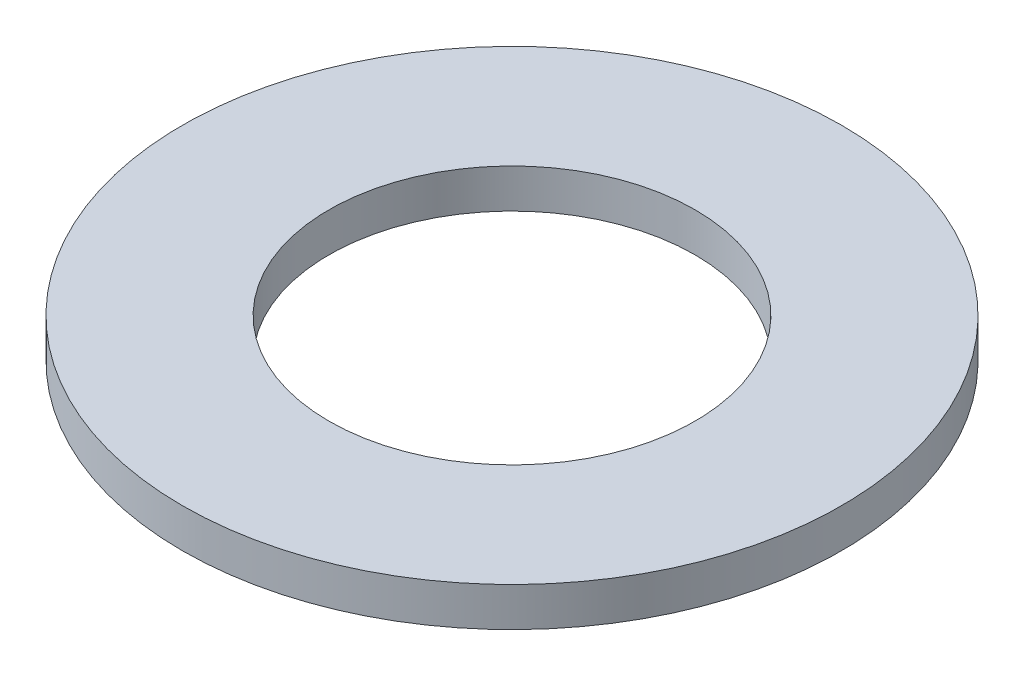
from build123d import *

# Parameters (mm, degrees)
SKETCH1_R           = 67.5
BOSS_EXTRUDE1_DEPTH = 8
SKETCH2_R           = 37.5
CUT_EXTRUDE1_DEPTH  = 96.79404992


with BuildPart() as part:
    # Sketch1 → Boss-Extrude1 (new body)
    with BuildSketch(Plane(origin=(0, 0, 0), x_dir=(1, 0, 0), z_dir=(0, 1, 0))):
        Circle(SKETCH1_R)
    extrude(amount=BOSS_EXTRUDE1_DEPTH)

    # Sketch2 → Cut-Extrude1 (cut, through all)
    with BuildSketch(Plane(origin=(0, 0, 0), x_dir=(1, 0, 0), z_dir=(0, 1, 0))):
        Circle(SKETCH2_R)
    extrude(amount=CUT_EXTRUDE1_DEPTH, mode=Mode.SUBTRACT)


solid = part.part
